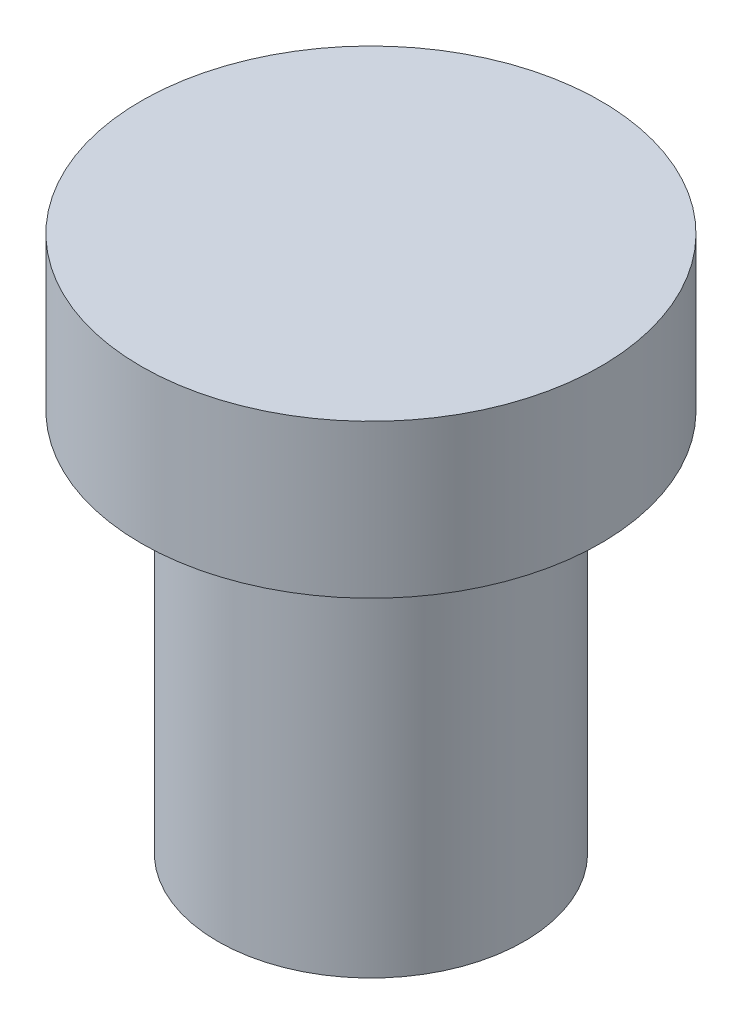
from build123d import *


with BuildPart() as part:
    # 스케치1 → 회전1 (revolve)
    with BuildSketch(Plane(origin=(0, 0, 0), x_dir=(0, 0, -1), z_dir=(1, 0, 0))):
        Polygon((0, 16.246180973), (3, 16.246180973), (3, 14.246180973), (2, 14.246180973), (2, 9.246180973), (0, 9.246180973), align=None)
    revolve(axis=Axis((0, 20.990482646, 0), (0, -1, 0)))


solid = part.part
